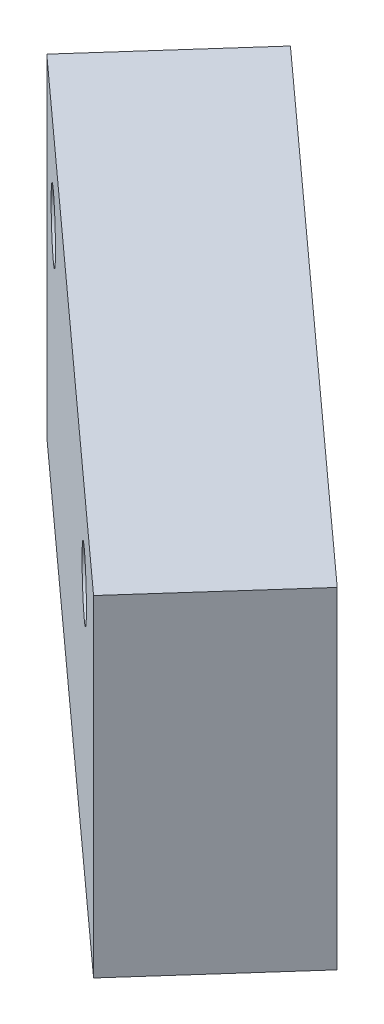
from build123d import *
from build123d.topology import SkipClean

# Parameters (mm, degrees)
SKETCH2_R           = 2.5
BOSS_EXTRUDE1_DEPTH = 7
FILLET1_R           = 90
BOSS_EXTRUDE3_DEPTH = 15
SKETCH4_R           = 8
CUT_EXTRUDE1_DEPTH  = 10
BOSS_EXTRUDE4_START = 10
BOSS_EXTRUDE4_DEPTH = 10
BOSS_EXTRUDE5_DEPTH = 27
SKETCH7_R           = 2.5
CUT_EXTRUDE2_DEPTH  = 37
INTERSECT3_DEPTH    = 27


with BuildPart() as part:
    # Sketch2 → Boss-Extrude1 (new body)
    with BuildSketch(Plane(origin=(0, 0, 0), x_dir=(1, 0, 0), z_dir=(0, 1, 0))):
        with BuildLine():
            Line((-4.24846021, -9.602113613), (13.572308451, -17.486922065))
            ThreePointArc((13.572308451, -17.486922065), (20.638500285, -15.805826469), (20.907079545, -8.547382103))
            Line((20.907079545, -8.547382103), (11.451696022, 4.891208687))
            ThreePointArc((11.451696022, 4.891208687), (9.270724445, 7.034926316), (6.472222222, 8.268031175))
            ThreePointArc((6.472222222, 8.268031175), (4.86754966, 9.30359932), (3.101845071, 10.031378627))
            Line((3.101845071, 10.031378627), (-8.821699821, 13.718308443))
            ThreePointArc((-8.821699821, 13.718308443), (-15.091857172, 11.987583677), (-16.147811194, 5.569231667))
            Line((-16.147811194, 5.569231667), (-12.308520784, -3.358124948))
            ThreePointArc((-12.308520784, -3.358124948), (-9.971976629, -6.504419403), (-6.472222222, -8.268031175))
            ThreePointArc((-6.472222222, -8.268031175), (-5.401685102, -9.003987898), (-4.24846021, -9.602113613))
        make_face()
        with Locations(Location((16, -12, 0), (0, 0, 270))):
            Circle(SKETCH2_R, mode=Mode.SUBTRACT)
        with Locations(Location((-10.604337088, 7.953252816, 0), (0, 0, 270))):
            Circle(SKETCH2_R, mode=Mode.SUBTRACT)
        with BuildLine():
            ThreePointArc((-4.694444444, -4.495797077), (0, -6.5), (4.694444444, -4.495797077))
            ThreePointArc((4.694444444, -4.495797077), (9, 0), (4.694444444, 4.495797077))
            ThreePointArc((4.694444444, 4.495797077), (0, 6.5), (-4.694444444, 4.495797077))
            ThreePointArc((-4.694444444, 4.495797077), (-9, 0), (-4.694444444, -4.495797077))
        make_face(mode=Mode.SUBTRACT)
    extrude(amount=BOSS_EXTRUDE1_DEPTH)

    # Fillet1
    fillet1_edges = [part.edges().sort_by_distance(p)[0] for p in [
        (6.472222222, 3.5, -8.268031175),
        (-6.472222222, 3.5, 8.268031175),
    ]]
    fillet(fillet1_edges, radius=FILLET1_R)

    # Sketch3 → Boss-Extrude3 (add)
    with BuildSketch(Plane(origin=(0, 7, 0), x_dir=(1, 0, 0), z_dir=(0, 1, 0))):
        with BuildLine():
            Line((-13.446880098, 1.012795393), (-12.308520784, -3.358124948))
            ThreePointArc((-12.308520784, -3.358124948), (-10.611843956, -5.907229762), (-8.121968415, -7.689690813))
            ThreePointArc((-8.121968415, -7.689690813), (-6.480430757, -8.483296944), (-4.855306799, -9.309994408))
            ThreePointArc((-4.855306799, -9.309994408), (-4.554226262, -9.460920841), (-4.24846021, -9.602113613))
            Line((-4.24846021, -9.602113613), (-1.454246479, -10.838414946))
            ThreePointArc((-1.454246479, -10.838414946), (10.979115699, -7.880432641), (11.451696022, 4.891208687))
            ThreePointArc((11.451696022, 4.891208687), (9.968863726, 6.507036925), (8.121968415, 7.689690813))
            ThreePointArc((8.121968415, 7.689690813), (6.480430757, 8.483296944), (4.855306799, 9.309994408))
            ThreePointArc((4.855306799, 9.309994408), (3.994892398, 9.710346787), (3.101845071, 10.031378627))
            Line((3.101845071, 10.031378627), (-3.895223267, 11.305534387))
            ThreePointArc((-3.895223267, 11.305534387), (-5.691953988, 10.727471116), (-6.207623157, 8.911848981))
            ThreePointArc((-6.207623157, 8.911848981), (-7.30582589, 4.892236012), (-11.232333003, 3.497288147))
            ThreePointArc((-11.232333003, 3.497288147), (-13.004436636, 2.847636589), (-13.446880098, 1.012795393))
        make_face()
        with BuildLine():
            ThreePointArc((4.694444444, -4.495797077), (9, 0), (4.694444444, 4.495797077))
            ThreePointArc((4.694444444, 4.495797077), (0, 6.5), (-4.694444444, 4.495797077))
            ThreePointArc((-4.694444444, 4.495797077), (-9, 0), (-4.694444444, -4.495797077))
            ThreePointArc((-4.694444444, -4.495797077), (0, -6.5), (4.694444444, -4.495797077))
        make_face(mode=Mode.SUBTRACT)
    extrude(amount=BOSS_EXTRUDE3_DEPTH)

    # Sketch4 → Cut-Extrude1 (cut)
    with BuildSketch(Plane(origin=(0, 22, 0), x_dir=(1, 0, 0), z_dir=(0, 1, 0))):
        Circle(SKETCH4_R)
    extrude(amount=-CUT_EXTRUDE1_DEPTH, mode=Mode.SUBTRACT)

    # Sketch5 → Boss-Extrude4 (add)
    with SkipClean():  # the faces are left unmerged after this step: merging them gives an invalid solid
        with BuildSketch(Plane(origin=(0, 12, 0), x_dir=(1, 0, 0), z_dir=(0, 1, 0)).offset(BOSS_EXTRUDE4_START)):
            with BuildLine():
                ThreePointArc((-7.111111111, 3.664982778), (-8, 0), (-7.111111111, -3.664982778))
                ThreePointArc((-7.111111111, -3.664982778), (-9, 0), (-7.111111111, 3.664982778))
            make_face()
            with BuildLine():
                ThreePointArc((7.111111111, -3.664982778), (9, 0), (7.111111111, 3.664982778))
                ThreePointArc((7.111111111, 3.664982778), (8, 0), (7.111111111, -3.664982778))
            make_face()
        extrude(amount=-BOSS_EXTRUDE4_DEPTH)


with BuildPart() as body_2:
    # Sketch6 → Boss-Extrude5 (new body)
    with BuildSketch(Plane(origin=(0, 0, 0), x_dir=(-1, 0, 0), z_dir=(0, -1, 0))):
        Polygon((8.401052482, 26.937158796), (-31.729302738, -9.377746691), (-13.016359271, -30.388770935), (27.113995949, 5.926134553), align=None)
    extrude(amount=-BOSS_EXTRUDE5_DEPTH)

    # Sketch7 → Cut-Extrude2 (cut)
    with BuildSketch(Plane(origin=(-9.25873614, 0, 10.23151142), x_dir=(0.7414761288495602, 0, 0.670979247329059), z_dir=(-0.670979247329059, 0, 0.7414761288495602))):
        with Locations((-16.542969249, 20.228212297)):
            Circle(SKETCH7_R)
        with Locations((19.254983261, 20.228212297)):
            Circle(SKETCH7_R)
    extrude(amount=-CUT_EXTRUDE2_DEPTH, mode=Mode.SUBTRACT)

    # Intersect1: read off the stored shape, not the designer's step
    # Intersect1: cut part
    add(part.part, mode=Mode.SUBTRACT)

    # Intersect3: read off the stored shape, not the designer's step
    # Intersect3 outline → Intersect3 (cut)
    with BuildSketch(Plane(origin=(0, 0, 0), x_dir=(1, 0, 0), z_dir=(0, 1, 0))):
        Polygon((22.372831004, -19.883258813), (31.729302738, -9.377746691), (-8.401052482, 26.937158796), (-17.757524215, 16.431646675), align=None)
    extrude(amount=INTERSECT3_DEPTH, mode=Mode.SUBTRACT)


solid = body_2.part
